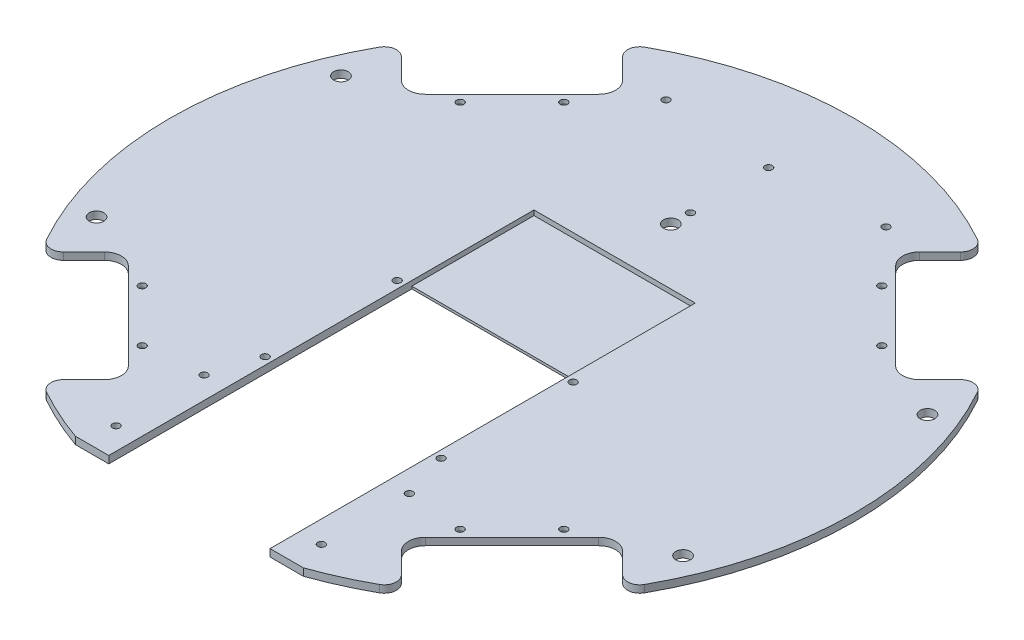
from build123d import *

# Parameters (mm, degrees)
SKETCH1_R                = 140
BOSS_EXTRUDE1_DEPTH      = 3
CUT_EXTRUDE4_REACH       = 200.013
CUT_EXTRUDE6_REACH       = 200.013
SKETCH9_R                = 1.5
FILLET1_R                = 5
CIRPATTERN1_COUNT        = 4
FILLET1_OF_CIRPATTERN1_R = 5
CUT_EXTRUDE1_REACH       = 200.013
FILLET3_R                = 1.5
CUT_EXTRUDE7_REACH       = 200.013
SKETCH10_R               = 1.5
CUT_EXTRUDE9_REACH       = 200.013
SKETCH13_R               = 1.5
CUT_EXTRUDE12_REACH      = 200.013
SKETCH16_R               = 1.5
SKETCH16_R_2             = 3
CUT_EXTRUDE13_REACH      = 200.013
SKETCH17_R               = 3
SKETCH18_W               = 66
SKETCH18_H               = 50
CUT_EXTRUDE14_DEPTH      = 2


with BuildPart() as part:
    # Sketch1 → Boss-Extrude1 (new body)
    with BuildSketch(Plane(origin=(0, 0, 0), x_dir=(1, 0, 0), z_dir=(0, 1, 0))):
        Circle(SKETCH1_R)
    extrude(amount=BOSS_EXTRUDE1_DEPTH)

    # Sketch7 → Cut-Extrude4 (cut, up to next)
    with BuildSketch(Plane(origin=(0, 3, 0), x_dir=(1, 0, 0), z_dir=(0, 1, 0)), mode=Mode.PRIVATE) as cut_extrude4_sk1:
        with BuildLine():
            Line((-96.20187758, -60.775827843), (-60.775827843, -96.20187758))
            ThreePointArc((-60.775827843, -96.20187758), (-58.740219972, -101.11626971), (-60.775827843, -106.030661839))
            Line((-60.775827843, -106.030661839), (-76.367532368, -121.622366364))
            Line((-76.367532368, -121.622366364), (-121.622366364, -76.367532368))
            Line((-121.622366364, -76.367532368), (-106.030661839, -60.775827843))
            ThreePointArc((-106.030661839, -60.775827843), (-101.11626971, -58.740219972), (-96.20187758, -60.775827843))
        make_face()
    cut_extrude4_tool1 = extrude(cut_extrude4_sk1.sketch, amount=-CUT_EXTRUDE4_REACH, mode=Mode.PRIVATE) & part.part
    cut_extrude4 = cut_extrude4_tool1.solids().sort_by_distance((-88.845322, 3, 88.845322))[0]
    add(cut_extrude4, mode=Mode.SUBTRACT)

    # Sketch9 → Cut-Extrude6 (cut, up to next)
    with BuildSketch(Plane(origin=(0, 3, 0), x_dir=(1, 0, 0), z_dir=(0, 1, 0)), mode=Mode.PRIVATE) as cut_extrude6_sk1:
        with Locations((-86.267027305, -65.053823869)):
            Circle(SKETCH9_R)
    cut_extrude6_tool1 = extrude(cut_extrude6_sk1.sketch, amount=-CUT_EXTRUDE6_REACH, mode=Mode.PRIVATE) & part.part
    # Sketch9 → Cut-Extrude6 (cut, up to next)
    with BuildSketch(Plane(origin=(0, 3, 0), x_dir=(1, 0, 0), z_dir=(0, 1, 0)), mode=Mode.PRIVATE) as cut_extrude6_sk2:
        with Locations((-65.053823869, -86.267027305)):
            Circle(SKETCH9_R)
    cut_extrude6_tool2 = extrude(cut_extrude6_sk2.sketch, amount=-CUT_EXTRUDE6_REACH, mode=Mode.PRIVATE) & part.part
    cut_extrude6_1 = cut_extrude6_tool1.solids().sort_by_distance((-86.267027, 3, 65.053824))[0]
    add(cut_extrude6_1, mode=Mode.SUBTRACT)
    cut_extrude6_2 = cut_extrude6_tool2.solids().sort_by_distance((-65.053824, 3, 86.267027))[0]
    add(cut_extrude6_2, mode=Mode.SUBTRACT)
    cut_extrude6 = cut_extrude6_1 + cut_extrude6_2  # Cut-Extrude6 as one shape, for the pattern or mirror that repeats it

    # Fillet1
    fillet1_edges = [part.edges().sort_by_distance(p)[0] for p in [
        (-73.746853427, 1.5, 119.001687423),
        (-119.001687423, 1.5, 73.746853427),
    ]]
    fillet(fillet1_edges, radius=FILLET1_R)

    # CirPattern1: Cut-Extrude4, Cut-Extrude6 ×4 about axis
    cirpattern1_axis = Axis((0, 3, 0), (0, 1, 0))
    add([cut_extrude4.rotate(cirpattern1_axis, i * 360 / CIRPATTERN1_COUNT) for i in range(1, CIRPATTERN1_COUNT)], mode=Mode.SUBTRACT)
    add([cut_extrude6.rotate(cirpattern1_axis, i * 360 / CIRPATTERN1_COUNT) for i in range(1, CIRPATTERN1_COUNT)], mode=Mode.SUBTRACT)

    # Fillet1 of CirPattern1
    fillet1_of_cirpattern1_edges = [part.edges().sort_by_distance(p)[0] for p in [
        (119.001687423, 1.5, 73.746853427),
        (73.746853427, 1.5, 119.001687423),
        (73.746853427, 1.5, -119.001687423),
        (119.001687423, 1.5, -73.746853427),
        (-119.001687423, 1.5, -73.746853427),
        (-73.746853427, 1.5, -119.001687423),
    ]]
    fillet(fillet1_of_cirpattern1_edges, radius=FILLET1_OF_CIRPATTERN1_R)

    # Sketch2 → Cut-Extrude1 (cut, up to next)
    with BuildSketch(Plane(origin=(0, 3, 0), x_dir=(1, 0, 0), z_dir=(0, 1, 0)), mode=Mode.PRIVATE) as cut_extrude1_sk1:
        Polygon((-46.647615159, -132), (-33, -132), (-33, -8), (33, -8), (33, -132), (46.647615159, -132), (46.647615159, -140), (-46.647615159, -140), align=None)
    cut_extrude1_tool1 = extrude(cut_extrude1_sk1.sketch, amount=-CUT_EXTRUDE1_REACH, mode=Mode.PRIVATE) & part.part
    add(cut_extrude1_tool1.solids().sort_by_distance((0, 3, 75.516001))[0], mode=Mode.SUBTRACT)

    # Fillet3
    fillet3_edges = [part.edges().sort_by_distance(p)[0] for p in [
        (65.053823869, 0, 87.767027305),
        (86.267027305, 0, 66.553823869),
        (87.767027305, 0, -65.053823869),
        (66.553823869, 0, -86.267027305),
        (-65.053823869, 0, -87.767027305),
        (-86.267027305, 0, -66.553823869),
        (-66.553823869, 0, 86.267027305),
        (-87.767027305, 0, 65.053823869),
    ]]
    fillet(fillet3_edges, radius=FILLET3_R)

    # Sketch10 → Cut-Extrude7 (cut, up to next)
    with BuildSketch(Plane(origin=(0, 3, 0), x_dir=(1, 0, 0), z_dir=(0, 1, 0)), mode=Mode.PRIVATE) as cut_extrude7_sk1:
        with Locations((-36, -65)):
            Circle(SKETCH10_R)
    cut_extrude7_tool1 = extrude(cut_extrude7_sk1.sketch, amount=-CUT_EXTRUDE7_REACH, mode=Mode.PRIVATE) & part.part
    # Sketch10 → Cut-Extrude7 (cut, up to next)
    with BuildSketch(Plane(origin=(0, 3, 0), x_dir=(1, 0, 0), z_dir=(0, 1, 0)), mode=Mode.PRIVATE) as cut_extrude7_sk2:
        with Locations((36, -65)):
            Circle(SKETCH10_R)
    cut_extrude7_tool2 = extrude(cut_extrude7_sk2.sketch, amount=-CUT_EXTRUDE7_REACH, mode=Mode.PRIVATE) & part.part
    # Sketch10 → Cut-Extrude7 (cut, up to next)
    with BuildSketch(Plane(origin=(0, 3, 0), x_dir=(1, 0, 0), z_dir=(0, 1, 0)), mode=Mode.PRIVATE) as cut_extrude7_sk3:
        with Locations((-36, -11)):
            Circle(SKETCH10_R)
    cut_extrude7_tool3 = extrude(cut_extrude7_sk3.sketch, amount=-CUT_EXTRUDE7_REACH, mode=Mode.PRIVATE) & part.part
    # Sketch10 → Cut-Extrude7 (cut, up to next)
    with BuildSketch(Plane(origin=(0, 3, 0), x_dir=(1, 0, 0), z_dir=(0, 1, 0)), mode=Mode.PRIVATE) as cut_extrude7_sk4:
        with Locations((36, -11)):
            Circle(SKETCH10_R)
    cut_extrude7_tool4 = extrude(cut_extrude7_sk4.sketch, amount=-CUT_EXTRUDE7_REACH, mode=Mode.PRIVATE) & part.part
    add(cut_extrude7_tool1.solids().sort_by_distance((-36, 3, 65))[0], mode=Mode.SUBTRACT)
    add(cut_extrude7_tool2.solids().sort_by_distance((36, 3, 65))[0], mode=Mode.SUBTRACT)
    add(cut_extrude7_tool3.solids().sort_by_distance((-36, 3, 11))[0], mode=Mode.SUBTRACT)
    add(cut_extrude7_tool4.solids().sort_by_distance((36, 3, 11))[0], mode=Mode.SUBTRACT)

    # Sketch13 → Cut-Extrude9 (cut, up to next)
    with BuildSketch(Plane(origin=(0, 3, 0), x_dir=(1, 0, 0), z_dir=(0, 1, 0)), mode=Mode.PRIVATE) as cut_extrude9_sk1:
        with Locations((-42, -84)):
            Circle(SKETCH13_R)
    cut_extrude9_tool1 = extrude(cut_extrude9_sk1.sketch, amount=-CUT_EXTRUDE9_REACH, mode=Mode.PRIVATE) & part.part
    # Sketch13 → Cut-Extrude9 (cut, up to next)
    with BuildSketch(Plane(origin=(0, 3, 0), x_dir=(1, 0, 0), z_dir=(0, 1, 0)), mode=Mode.PRIVATE) as cut_extrude9_sk2:
        with Locations((-42, -120)):
            Circle(SKETCH13_R)
    cut_extrude9_tool2 = extrude(cut_extrude9_sk2.sketch, amount=-CUT_EXTRUDE9_REACH, mode=Mode.PRIVATE) & part.part
    # Sketch13 → Cut-Extrude9 (cut, up to next)
    with BuildSketch(Plane(origin=(0, 3, 0), x_dir=(1, 0, 0), z_dir=(0, 1, 0)), mode=Mode.PRIVATE) as cut_extrude9_sk3:
        with Locations((42, -120)):
            Circle(SKETCH13_R)
    cut_extrude9_tool3 = extrude(cut_extrude9_sk3.sketch, amount=-CUT_EXTRUDE9_REACH, mode=Mode.PRIVATE) & part.part
    # Sketch13 → Cut-Extrude9 (cut, up to next)
    with BuildSketch(Plane(origin=(0, 3, 0), x_dir=(1, 0, 0), z_dir=(0, 1, 0)), mode=Mode.PRIVATE) as cut_extrude9_sk4:
        with Locations((42, -84)):
            Circle(SKETCH13_R)
    cut_extrude9_tool4 = extrude(cut_extrude9_sk4.sketch, amount=-CUT_EXTRUDE9_REACH, mode=Mode.PRIVATE) & part.part
    add(cut_extrude9_tool1.solids().sort_by_distance((-42, 3, 84))[0], mode=Mode.SUBTRACT)
    add(cut_extrude9_tool2.solids().sort_by_distance((-42, 3, 120))[0], mode=Mode.SUBTRACT)
    add(cut_extrude9_tool3.solids().sort_by_distance((42, 3, 120))[0], mode=Mode.SUBTRACT)
    add(cut_extrude9_tool4.solids().sort_by_distance((42, 3, 84))[0], mode=Mode.SUBTRACT)

    # Sketch16 → Cut-Extrude12 (cut, up to next)
    with BuildSketch(Plane(origin=(0, 3, 0), x_dir=(1, 0, 0), z_dir=(0, 1, 0)), mode=Mode.PRIVATE) as cut_extrude12_sk1:
        with Locations((0, 73)):
            Circle(SKETCH16_R)
    cut_extrude12_tool1 = extrude(cut_extrude12_sk1.sketch, amount=-CUT_EXTRUDE12_REACH, mode=Mode.PRIVATE) & part.part
    # Sketch16 → Cut-Extrude12 (cut, up to next)
    with BuildSketch(Plane(origin=(0, 3, 0), x_dir=(1, 0, 0), z_dir=(0, 1, 0)), mode=Mode.PRIVATE) as cut_extrude12_sk2:
        with Locations((-45, 108)):
            Circle(SKETCH16_R)
    cut_extrude12_tool2 = extrude(cut_extrude12_sk2.sketch, amount=-CUT_EXTRUDE12_REACH, mode=Mode.PRIVATE) & part.part
    # Sketch16 → Cut-Extrude12 (cut, up to next)
    with BuildSketch(Plane(origin=(0, 3, 0), x_dir=(1, 0, 0), z_dir=(0, 1, 0)), mode=Mode.PRIVATE) as cut_extrude12_sk3:
        with Locations((45, 108)):
            Circle(SKETCH16_R)
    cut_extrude12_tool3 = extrude(cut_extrude12_sk3.sketch, amount=-CUT_EXTRUDE12_REACH, mode=Mode.PRIVATE) & part.part
    # Sketch16 → Cut-Extrude12 (cut, up to next)
    with BuildSketch(Plane(origin=(0, 3, 0), x_dir=(1, 0, 0), z_dir=(0, 1, 0)), mode=Mode.PRIVATE) as cut_extrude12_sk4:
        with Locations((0, 105)):
            Circle(SKETCH16_R)
    cut_extrude12_tool4 = extrude(cut_extrude12_sk4.sketch, amount=-CUT_EXTRUDE12_REACH, mode=Mode.PRIVATE) & part.part
    # Sketch16 → Cut-Extrude12 (cut, up to next)
    with BuildSketch(Plane(origin=(0, 3, 0), x_dir=(1, 0, 0), z_dir=(0, 1, 0)), mode=Mode.PRIVATE) as cut_extrude12_sk5:
        with Locations((0, 65)):
            Circle(SKETCH16_R_2)
    cut_extrude12_tool5 = extrude(cut_extrude12_sk5.sketch, amount=-CUT_EXTRUDE12_REACH, mode=Mode.PRIVATE) & part.part
    add(cut_extrude12_tool1.solids().sort_by_distance((0, 3, -73))[0], mode=Mode.SUBTRACT)
    add(cut_extrude12_tool2.solids().sort_by_distance((-45, 3, -108))[0], mode=Mode.SUBTRACT)
    add(cut_extrude12_tool3.solids().sort_by_distance((45, 3, -108))[0], mode=Mode.SUBTRACT)
    add(cut_extrude12_tool4.solids().sort_by_distance((0, 3, -105))[0], mode=Mode.SUBTRACT)
    add(cut_extrude12_tool5.solids().sort_by_distance((0, 3, -65))[0], mode=Mode.SUBTRACT)

    # Sketch17 → Cut-Extrude13 (cut, up to next)
    with BuildSketch(Plane(origin=(0, 3, 0), x_dir=(1, 0, 0), z_dir=(0, 1, 0)), mode=Mode.PRIVATE) as cut_extrude13_sk1:
        with Locations((-120, 50)):
            Circle(SKETCH17_R)
    cut_extrude13_tool1 = extrude(cut_extrude13_sk1.sketch, amount=-CUT_EXTRUDE13_REACH, mode=Mode.PRIVATE) & part.part
    # Sketch17 → Cut-Extrude13 (cut, up to next)
    with BuildSketch(Plane(origin=(0, 3, 0), x_dir=(1, 0, 0), z_dir=(0, 1, 0)), mode=Mode.PRIVATE) as cut_extrude13_sk2:
        with Locations((-120, -50)):
            Circle(SKETCH17_R)
    cut_extrude13_tool2 = extrude(cut_extrude13_sk2.sketch, amount=-CUT_EXTRUDE13_REACH, mode=Mode.PRIVATE) & part.part
    # Sketch17 → Cut-Extrude13 (cut, up to next)
    with BuildSketch(Plane(origin=(0, 3, 0), x_dir=(1, 0, 0), z_dir=(0, 1, 0)), mode=Mode.PRIVATE) as cut_extrude13_sk3:
        with Locations((120, 50)):
            Circle(SKETCH17_R)
    cut_extrude13_tool3 = extrude(cut_extrude13_sk3.sketch, amount=-CUT_EXTRUDE13_REACH, mode=Mode.PRIVATE) & part.part
    # Sketch17 → Cut-Extrude13 (cut, up to next)
    with BuildSketch(Plane(origin=(0, 3, 0), x_dir=(1, 0, 0), z_dir=(0, 1, 0)), mode=Mode.PRIVATE) as cut_extrude13_sk4:
        with Locations((120, -50)):
            Circle(SKETCH17_R)
    cut_extrude13_tool4 = extrude(cut_extrude13_sk4.sketch, amount=-CUT_EXTRUDE13_REACH, mode=Mode.PRIVATE) & part.part
    add(cut_extrude13_tool1.solids().sort_by_distance((-120, 3, -50))[0], mode=Mode.SUBTRACT)
    add(cut_extrude13_tool2.solids().sort_by_distance((-120, 3, 50))[0], mode=Mode.SUBTRACT)
    add(cut_extrude13_tool3.solids().sort_by_distance((120, 3, -50))[0], mode=Mode.SUBTRACT)
    add(cut_extrude13_tool4.solids().sort_by_distance((120, 3, 50))[0], mode=Mode.SUBTRACT)

    # Sketch18 → Cut-Extrude14 (cut)
    with BuildSketch(Plane(origin=(0, 3, 0), x_dir=(1, 0, 0), z_dir=(0, 1, 0))):
        with Locations((0, 17)):
            Rectangle(SKETCH18_W, SKETCH18_H)
    extrude(amount=-CUT_EXTRUDE14_DEPTH, mode=Mode.SUBTRACT)


solid = part.part
